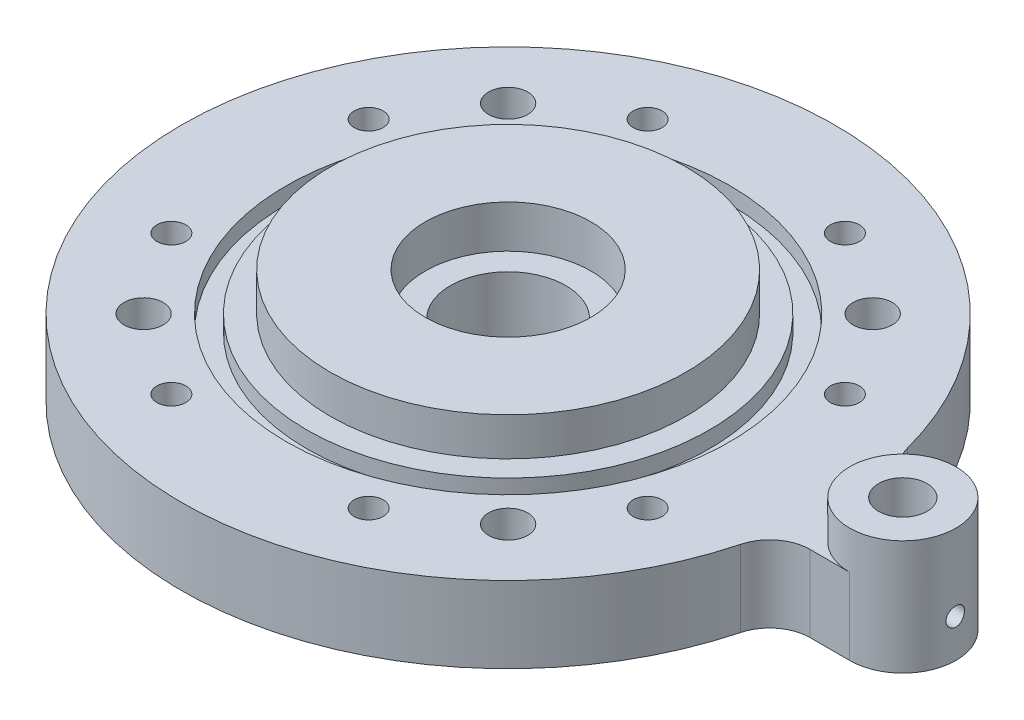
from build123d import *

# Parameters (mm, degrees)
BASE_DEPTH                       = 13.175
SKETCH3_R                        = 3.373437
SKETCH3_R_2                      = 3.373438
SQUARE_BOLT_HOLES_DEPTH          = 97.509984
SKETCH4_R                        = 2.5
HOUSING_BOLTS_DEPTH              = 44.33
CIRPATTERN1_COUNT                = 8
SKETCH2_R                        = 30.6705
SKETCH2_R_2                      = 9.167187
SKETCH2_R_3                      = 4.167187
IMPELLER_CAVITY_RISER_DEPTH      = 6.59
SKETCH5_R                        = 14.2875
SEAL_BORE_DEPTH                  = 7.35
SKETCH6_R                        = 9.9375
BORE_DEPTH                       = 39.3
PRESSURE_TAP_DEPTH               = 128.557006
PRESSURE_TAP_DEPTH_BACK          = 56.35625
SKETCH9_R                        = 1.5875
SKETCH10_R                       = 1.5875
PRESSURE_TAP_VERTICAL_HOLE_DEPTH = 8.175
SKETCH12_R                       = 38.2524
SKETCH12_R_2                     = 34.7218
O_RING_FEATURE_DEPTH             = 2.82448


with BuildPart() as part:
    # Sketch1 → base (new body)
    with BuildSketch(Plane(origin=(0, 0, 0), x_dir=(1, 0, 0), z_dir=(0, 1, 0))):
        with BuildLine():
            Line((61.258766, 9.167187), (68.063437, 9.167187))
            ThreePointArc((68.063437, 9.167187), (77.230625, 0), (68.063437, -9.167187))
            Line((68.063437, -9.167187), (61.258766, -9.167187))
            ThreePointArc((61.258766, -9.167187), (56.986985, -10.621749), (54.49051, -14.380934))
            ThreePointArc((54.49051, -14.380934), (-56.35625, 0), (54.49051, 14.380934))
            ThreePointArc((54.49051, 14.380934), (56.986985, 10.621749), (61.258766, 9.167187))
        make_face()
    extrude(amount=BASE_DEPTH)

    # Sketch3 → square bolt holes (cut, through all)
    with BuildSketch(Plane.XZ):
        with Locations((-31.430896, -31.430896)):
            Circle(SKETCH3_R)
        with Locations((-31.430896, 31.430896)):
            Circle(SKETCH3_R)
        with Locations((31.430896, 31.430896)):
            Circle(SKETCH3_R_2)
        with Locations((31.430896, -31.430896)):
            Circle(SKETCH3_R_2)
    extrude(amount=-SQUARE_BOLT_HOLES_DEPTH, mode=Mode.SUBTRACT)

    # Sketch4 → housing bolts (cut)
    with BuildSketch(Plane(origin=(0, 13.175, 0), x_dir=(1, 0, 0), z_dir=(0, 1, 0))):
        with Locations((17.010279, 41.066445)):
            Circle(SKETCH4_R)
    housing_bolts = extrude(amount=-HOUSING_BOLTS_DEPTH, mode=Mode.SUBTRACT)

    # CirPattern1: housing bolts ×8 about axis
    cirpattern1_axis = Axis((0, 13.175, 0), (0, 1, 0))
    for i in range(1, CIRPATTERN1_COUNT):
        add(housing_bolts.rotate(cirpattern1_axis, i * 360 / CIRPATTERN1_COUNT), mode=Mode.SUBTRACT)

    # Sketch2 → impeller cavity riser (add)
    # profile 1 of 2: a face of its own
    with BuildSketch(Plane(origin=(0, 13.175, 0), x_dir=(1, 0, 0), z_dir=(0, 1, 0))):
        Circle(SKETCH2_R)
    # profile 2 of 2: a face of its own
    with BuildSketch(Plane(origin=(0, 13.175, 0), x_dir=(1, 0, 0), z_dir=(0, 1, 0))):
        with Locations((68.063437, 0)):
            Circle(SKETCH2_R_2)
        with Locations((68.063437, 0)):
            Circle(SKETCH2_R_3, mode=Mode.SUBTRACT)
    extrude(amount=IMPELLER_CAVITY_RISER_DEPTH)

    # Sketch5 → seal bore (cut)
    with BuildSketch(Plane(origin=(0, 19.765, 0), x_dir=(1, 0, 0), z_dir=(0, 1, 0))):
        Circle(SKETCH5_R)
    extrude(amount=-SEAL_BORE_DEPTH, mode=Mode.SUBTRACT)

    # Sketch6 → bore (cut)
    with BuildSketch(Plane(origin=(0, 12.415, 0), x_dir=(1, 0, 0), z_dir=(0, 1, 0))):
        Circle(SKETCH6_R)
    extrude(amount=-BORE_DEPTH, mode=Mode.SUBTRACT)

    # Sketch9 → pressure tap (cut, two sides: drawn at the far end of the back side and taken through both)
    with BuildSketch(Plane(origin=(56.35625, 0, 0), x_dir=(0, 0, -1), z_dir=(1, 0, 0)).offset(-PRESSURE_TAP_DEPTH_BACK)):
        with Locations((0, 6.5875)):
            Circle(SKETCH9_R)
    extrude(amount=PRESSURE_TAP_DEPTH + PRESSURE_TAP_DEPTH_BACK, mode=Mode.SUBTRACT)

    # Sketch10 → pressure tap vertical hole (cut)
    with BuildSketch(Plane(origin=(0, 13.175, 0), x_dir=(1, 0, 0), z_dir=(0, 1, 0))):
        with Locations((68.063437, 0)):
            Circle(SKETCH10_R)
    extrude(amount=-PRESSURE_TAP_VERTICAL_HOLE_DEPTH, mode=Mode.SUBTRACT)

    # Sketch12 → o ring feature (cut)
    with BuildSketch(Plane(origin=(0, 13.175, 0), x_dir=(1, 0, 0), z_dir=(0, 1, 0))):
        Circle(SKETCH12_R)
        Circle(SKETCH12_R_2, mode=Mode.SUBTRACT)
    extrude(amount=-O_RING_FEATURE_DEPTH, mode=Mode.SUBTRACT)


solid = part.part
